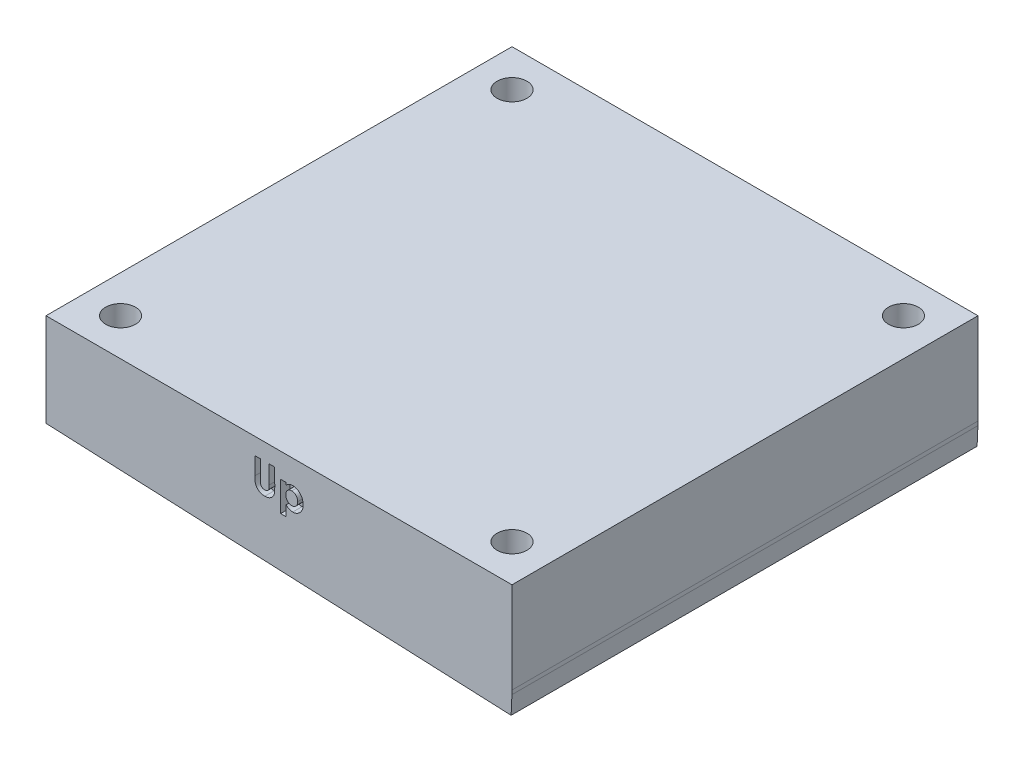
from build123d import *

# Parameters (mm, degrees)
SKETCH1_W           = 50
SKETCH1_H           = 50
BOSS_EXTRUDE1_DEPTH = 10
LOFT1_START         = -25
LOFT1_DEPTH         = 50
SKETCH4_R           = 1.6
CUT_EXTRUDE1_DEPTH  = 4
SKETCH6_R           = 1.6
CUT_EXTRUDE2_DEPTH  = 4
FILLET1_R           = 10
CUT_EXTRUDE4_DEPTH  = 1


# Read off the part's stored shape, not the designer's step: Loft1
with BuildPart() as part:
    # Sketch1 → Boss-Extrude1 (new body)
    with BuildSketch(Plane(origin=(0, 0, 0), x_dir=(1, 0, 0), z_dir=(0, 1, 0))):
        Rectangle(SKETCH1_W, SKETCH1_H)
    extrude(amount=BOSS_EXTRUDE1_DEPTH)

    # Loft1 outline → Loft1 (add)
    with BuildSketch(Plane.XY.offset(LOFT1_START)):
        Polygon((25, 0), (-25, 0), (24.904867452, -2.178893569), align=None)
    extrude(amount=LOFT1_DEPTH)

    # Sketch4 → Cut-Extrude1 (cut)
    with BuildSketch(Plane(origin=(-0.047566274, -1.089446784, 0), x_dir=(0.9990482215818578, -0.043619387365336104, 0), z_dir=(-0.043619387365336104, -0.9990482215818578, 0))):
        with Locations((20, 20)):
            Circle(SKETCH4_R)
        with Locations((20, -20)):
            Circle(SKETCH4_R)
        with Locations((-20, -20)):
            Circle(SKETCH4_R)
        with Locations((-20, 20)):
            Circle(SKETCH4_R)
    extrude(amount=-CUT_EXTRUDE1_DEPTH, mode=Mode.SUBTRACT)

    # Sketch6 → Cut-Extrude2 (cut)
    with BuildSketch(Plane(origin=(0, 10, 0), x_dir=(1, 0, 0), z_dir=(0, 1, 0))):
        with Locations(Location((21, 21, 0), (0, 0, 270))):
            Circle(SKETCH6_R)
        with Locations(Location((21, -21, 0), (0, 0, 270))):
            Circle(SKETCH6_R)
        with Locations(Location((-21, -21, 0), (0, 0, 270))):
            Circle(SKETCH6_R)
        with Locations(Location((-21, 21, 0), (0, 0, 270))):
            Circle(SKETCH6_R)
    extrude(amount=-CUT_EXTRUDE2_DEPTH, mode=Mode.SUBTRACT)

    # Fillet1
    # the kernel refuses this fillet: 10 mm, written as the material it takes off along each edge
    with BuildSketch(Plane(origin=(25, 0, -25.545501942), x_dir=(0, 1, 0), z_dir=(0, 0, 1))) as fillet1_piece_1:
        with BuildLine():
            CenterArc((FILLET1_R * 0.0218200776863, FILLET1_R), FILLET1_R, 267.499999993, 2.500000007)
            Line((-FILLET1_R * 0.0217993098072, FILLET1_R * 0.00095177842374), (0, 0))
            Line((0, 0), (FILLET1_R * 0.0218200776863, 0))
        make_face()
    extrude(amount=51.091003884, mode=Mode.SUBTRACT)

    # Sketch8 → Cut-Extrude4 (cut)
    # profile 1 of 2: a face of its own
    with BuildSketch(Plane.XY.offset(25)):
        with BuildLine():
            Line((-2.597489017, 8.20661879), (-1.993908288, 8.207890825))
            Line((-1.993908288, 8.207890825), (-1.990092182, 6.164366186))
            add(Edge.make_bspline(
                [(-1.990092182, 6.164366186), (-1.990044981, 6.143161949), (-1.989954316, 6.102432362), (-1.98719006, 6.043693532), (-1.983535675, 5.989812448), (-1.978474748, 5.940590206), (-1.972213443, 5.896230054), (-1.964810654, 5.856420037), (-1.955356589, 5.821562302), (-1.941074869, 5.781805473), (-1.918545267, 5.737393222), (-1.88297912, 5.690959505), (-1.840900192, 5.649204853), (-1.791278495, 5.613903537), (-1.735063778, 5.584986173), (-1.672775576, 5.56486761), (-1.605162185, 5.552435164), (-1.558292927, 5.551231377), (-1.534067542, 5.550609174)],
                knots=[0, 0, 0, 0, 1.152644125, 2.214025477, 3.196161738, 4.088430453, 4.903432181, 5.631297626, 6.288373025, 6.86443571, 7.926317597, 8.979784177, 10.031167994, 11.137891127, 12.27708747, 13.454363037, 14.684232779, 16, 16, 16, 16], degree=3))
            add(Edge.make_bspline(
                [(-1.534067542, 5.550609174), (-1.508342778, 5.551344218), (-1.458392144, 5.552771477), (-1.38647613, 5.567260105), (-1.320175779, 5.590067607), (-1.260159607, 5.621972608), (-1.207784977, 5.661229411), (-1.163051106, 5.705642718), (-1.126756521, 5.754903538), (-1.104539344, 5.801287384), (-1.090919789, 5.843176805), (-1.082446638, 5.881122654), (-1.074798653, 5.925478097), (-1.068502962, 5.975979624), (-1.064302042, 6.033085663), (-1.061178272, 6.096494834), (-1.059289451, 6.166474936), (-1.059074503, 6.215246414), (-1.058962374, 6.240688301)],
                knots=[0, 0, 0, 0, 1.271674988, 2.469253807, 3.614054625, 4.731162594, 5.818153213, 6.841986676, 7.840949062, 8.831111795, 9.371942087, 10.018382253, 10.75320863, 11.599114249, 12.535801032, 13.586328523, 14.740896136, 16, 16, 16, 16], degree=3))
            Line((-1.058962374, 6.240688301), (-1.06277848, 8.20916286))
            Line((-1.06277848, 8.20916286), (-0.459197751, 8.210434896))
            Line((-0.459197751, 8.210434896), (-0.455381645, 6.327822716))
            add(Edge.make_bspline(
                [(-0.455381645, 6.327822716), (-0.455427497, 6.289659556), (-0.455515647, 6.21629181), (-0.458289071, 6.110918126), (-0.461814303, 6.014630937), (-0.467384408, 5.927444116), (-0.475128208, 5.849211971), (-0.483609602, 5.779962438), (-0.494254852, 5.719827409), (-0.511101496, 5.651616734), (-0.540202063, 5.573125016), (-0.584540214, 5.481851601), (-0.643443749, 5.393738081), (-0.711846857, 5.308083315), (-0.789095734, 5.22867752), (-0.873562656, 5.158654821), (-0.964207697, 5.099802482), (-1.061217352, 5.05236512), (-1.164968764, 5.015852552), (-1.276248979, 4.989816387), (-1.395852353, 4.974728231), (-1.478266961, 4.972397474), (-1.520711172, 4.971197115)],
                knots=[0, 0, 0, 0, 1.153606413, 2.21778028, 3.186276612, 4.066178262, 4.858206436, 5.562506921, 6.174709129, 6.703194428, 7.684393792, 8.699014322, 9.763766974, 10.880761115, 12.0092423, 13.106350137, 14.190711311, 15.268404456, 16.362982341, 17.508657393, 18.716937746, 20, 20, 20, 20], degree=3))
            add(Edge.make_bspline(
                [(-1.520711172, 4.971197115), (-1.548921319, 4.971725785), (-1.604368835, 4.972764896), (-1.686183271, 4.979779), (-1.765227448, 4.991850187), (-1.841591746, 5.008854994), (-1.914983671, 5.031425855), (-1.98589913, 5.05802141), (-2.054022722, 5.089780937), (-2.118688428, 5.126683391), (-2.179562073, 5.167512676), (-2.236618712, 5.210440833), (-2.289443467, 5.255799025), (-2.336824872, 5.304275742), (-2.38072026, 5.354640261), (-2.419200428, 5.408131493), (-2.453865888, 5.463682585), (-2.484516032, 5.522820121), (-2.511340089, 5.588612717), (-2.532761656, 5.663826937), (-2.552116951, 5.748901286), (-2.566727329, 5.844173393), (-2.578801096, 5.949614065), (-2.58762407, 6.065232271), (-2.592496247, 6.191248581), (-2.593270756, 6.278633173), (-2.593672911, 6.32400661)],
                knots=[0, 0, 0, 0, 1.02296857, 2.010661828, 2.975102012, 3.920728081, 4.844890381, 5.757306083, 6.665306112, 7.567395873, 8.454421116, 9.321634866, 10.155527794, 10.976419367, 11.777782189, 12.575893134, 13.363117526, 14.150529598, 14.988558697, 15.934809602, 16.983005217, 18.150875452, 19.427780756, 20.831133413, 22.354602744, 24, 24, 24, 24], degree=3))
            Line((-2.593672911, 6.32400661), (-2.597489017, 8.20661879))
        make_face()
    # profile 2 of 2: a face of its own
    with BuildSketch(Plane.XY.offset(25)):
        with BuildLine():
            Line((0.751773127, 7.391012504), (0.751773127, 7.133425365))
            add(Edge.make_bspline(
                [(0.751773127, 7.133425365), (0.778472329, 7.158935271), (0.83075507, 7.208889119), (0.91540949, 7.274289424), (1.003299732, 7.329052484), (1.094438334, 7.374170373), (1.188742293, 7.408966836), (1.286127124, 7.435040483), (1.386924841, 7.449591081), (1.455165046, 7.451662404), (1.489553576, 7.452706214)],
                knots=[0, 0, 0, 0, 1.07236104, 2.099912038, 3.101509264, 4.076695536, 5.049251982, 6.017409511, 7.000906107, 8, 8, 8, 8], degree=3))
            add(Edge.make_bspline(
                [(1.489553576, 7.452706214), (1.526924592, 7.451800756), (1.600743213, 7.450012213), (1.709259158, 7.433628514), (1.813580931, 7.40703223), (1.913508294, 7.369042139), (2.009538866, 7.32069025), (2.100531928, 7.260258837), (2.187555401, 7.189924161), (2.269207456, 7.10944842), (2.34355068, 7.020307883), (2.409944412, 6.92481222), (2.464182597, 6.822021375), (2.510876223, 6.7143822), (2.545388061, 6.599620476), (2.570855741, 6.479240849), (2.586463156, 6.352591682), (2.588293394, 6.266153935), (2.589228055, 6.222012103)],
                knots=[0, 0, 0, 0, 0.97285607, 1.921673578, 2.851140669, 3.772105152, 4.700636827, 5.645590137, 6.611463219, 7.611062552, 8.626324728, 9.631081099, 10.634121403, 11.648482193, 12.682506745, 13.749260973, 14.85059771, 16, 16, 16, 16], degree=3))
            add(Edge.make_bspline(
                [(2.589228055, 6.222012103), (2.588298537, 6.179349915), (2.586474919, 6.095651135), (2.570706926, 5.972853752), (2.545603057, 5.855183022), (2.509168603, 5.742953987), (2.462478649, 5.636026689), (2.405516744, 5.534470889), (2.338601572, 5.437871439), (2.261335844, 5.348453672), (2.177246838, 5.267258834), (2.089530639, 5.194426949), (1.996891996, 5.133719372), (1.900067324, 5.084592613), (1.799825884, 5.045403376), (1.695598692, 5.017296578), (1.58741629, 5.000400903), (1.513994179, 4.998170845), (1.476833223, 4.997042151)],
                knots=[0, 0, 0, 0, 1.112323361, 2.182262823, 3.223467608, 4.246437882, 5.254246404, 6.261812182, 7.278802008, 8.313998772, 9.338537047, 10.324801996, 11.283349242, 12.220607119, 13.15197435, 14.085554928, 15.031046561, 16, 16, 16, 16], degree=3))
            add(Edge.make_bspline(
                [(1.476833223, 4.997042151), (1.443713635, 4.997866298), (1.37847004, 4.999489817), (1.28239675, 5.013308287), (1.18972649, 5.035554908), (1.099816742, 5.066844085), (1.011800444, 5.108860697), (0.925752316, 5.163179132), (0.838187871, 5.226650427), (0.783321035, 5.276537488), (0.754953215, 5.302330613)],
                knots=[0, 0, 0, 0, 0.987385084, 1.945089202, 2.888259662, 3.826137757, 4.779238709, 5.78997447, 6.857349733, 8, 8, 8, 8], degree=3))
            Line((0.754953215, 5.302330613), (0.756861268, 4.201384099))
            Line((0.756861268, 4.201384099), (0.175541156, 4.200748081))
            Line((0.175541156, 4.200748081), (0.170453015, 7.390376486))
            Line((0.170453015, 7.390376486), (0.751773127, 7.391012504))
        make_face()
        with BuildLine():
            add(Edge.make_bspline(
                [(1.368710227, 6.911455212), (1.346213252, 6.910793906), (1.301889553, 6.909490995), (1.236800882, 6.900703018), (1.174825335, 6.884952495), (1.115281841, 6.865000801), (1.058891287, 6.838102927), (1.006158968, 6.804454728), (0.955302726, 6.766437156), (0.908795742, 6.721898104), (0.866041178, 6.673203682), (0.829171668, 6.620171725), (0.797662517, 6.563797157), (0.772116057, 6.503651781), (0.752619184, 6.439615962), (0.737765481, 6.372266556), (0.7295235, 6.301085467), (0.728674715, 6.252561314), (0.728240475, 6.227736262)],
                knots=[0, 0, 0, 0, 1.027737872, 2.024856463, 2.992617016, 3.945137832, 4.889499754, 5.838073507, 6.798830374, 7.785357117, 8.773878476, 9.754540506, 10.730023958, 11.719398922, 12.733354597, 13.783839577, 14.866207966, 16, 16, 16, 16], degree=3))
            add(Edge.make_bspline(
                [(0.728240475, 6.227736262), (0.728932743, 6.202275745), (0.730280627, 6.152702693), (0.738422537, 6.08005334), (0.75306485, 6.011292092), (0.773556922, 5.946234461), (0.798907779, 5.884714778), (0.830366781, 5.826871472), (0.867820106, 5.773025683), (0.91065126, 5.723370351), (0.95726968, 5.678357076), (1.007763484, 5.639224622), (1.06153695, 5.6068128), (1.1177563, 5.579922387), (1.176954499, 5.558646747), (1.239181745, 5.543528138), (1.30440737, 5.534333858), (1.348751423, 5.533585019), (1.371254297, 5.533205012)],
                knots=[0, 0, 0, 0, 1.150869826, 2.240808007, 3.29890037, 4.323262251, 5.319818076, 6.30175507, 7.2932304, 8.278527964, 9.261212744, 10.217617135, 11.159266914, 12.093623991, 13.030189547, 13.99700188, 14.983556707, 16, 16, 16, 16], degree=3))
            add(Edge.make_bspline(
                [(1.371254297, 5.533205012), (1.393128622, 5.533793245), (1.436452488, 5.534958287), (1.499904241, 5.544898072), (1.560968418, 5.559972722), (1.618912299, 5.581746332), (1.674296494, 5.609496131), (1.727218439, 5.643057943), (1.776798655, 5.683723983), (1.823930937, 5.729037604), (1.865777732, 5.77989361), (1.904183947, 5.833232179), (1.935119368, 5.891270601), (1.961360615, 5.951971312), (1.981219465, 6.016410897), (1.994773785, 6.083982305), (2.004336984, 6.154747505), (2.005017408, 6.203110383), (2.005363872, 6.227736262)],
                knots=[0, 0, 0, 0, 0.998586769, 1.977781659, 2.926627622, 3.867334799, 4.798423245, 5.752050313, 6.722974502, 7.722781292, 8.733270033, 9.727291971, 10.719614403, 11.730474272, 12.744298273, 13.79263617, 14.876033113, 16, 16, 16, 16], degree=3))
            add(Edge.make_bspline(
                [(2.005363872, 6.227736262), (2.004660421, 6.252347386), (2.003285885, 6.300437262), (1.995240688, 6.371000149), (1.980354194, 6.437720012), (1.960745423, 6.50128771), (1.935176776, 6.561395106), (1.903915874, 6.617963719), (1.867459395, 6.6715612), (1.824828199, 6.720411759), (1.778956571, 6.765724093), (1.728833044, 6.804678965), (1.676093164, 6.83793361), (1.620131268, 6.864855463), (1.561466804, 6.885779245), (1.499970245, 6.901242858), (1.435343762, 6.910334609), (1.391212006, 6.911076791), (1.368710227, 6.911455212)],
                knots=[0, 0, 0, 0, 1.128965526, 2.20598662, 3.251153905, 4.259863426, 5.253177665, 6.241051661, 7.220081141, 8.219894056, 9.210062323, 10.172878603, 11.125229178, 12.064585276, 13.014948265, 13.977126056, 14.968582519, 16, 16, 16, 16], degree=3))
        make_face(mode=Mode.SUBTRACT)
    extrude(amount=-CUT_EXTRUDE4_DEPTH, mode=Mode.SUBTRACT)


solid = part.part
